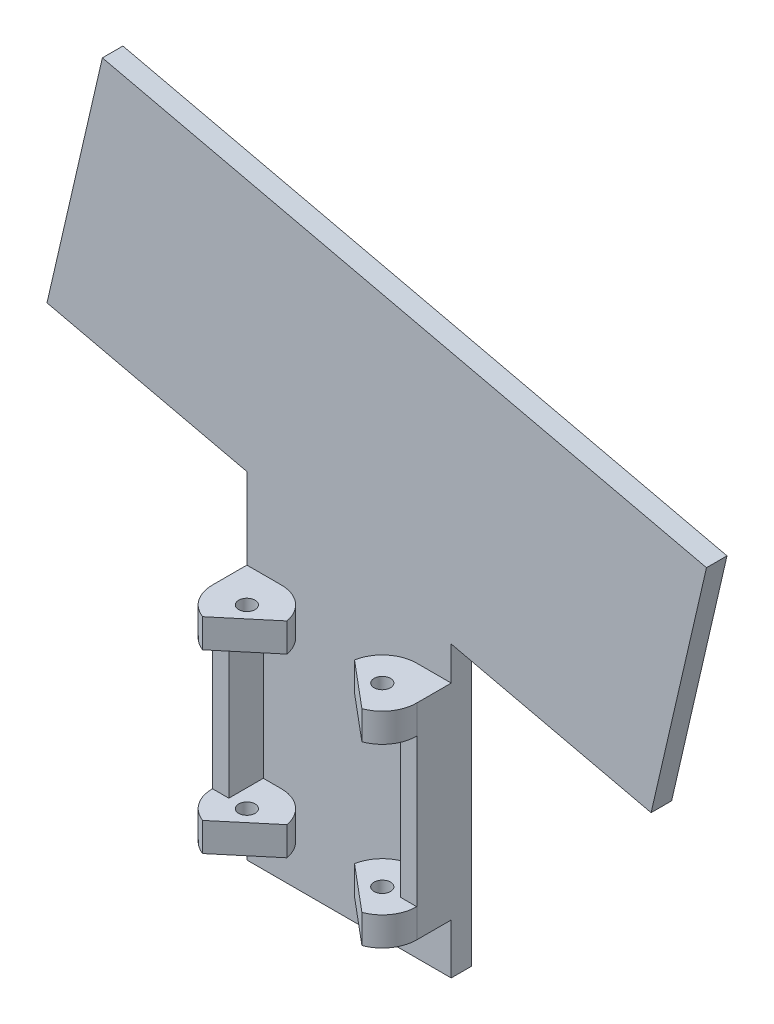
from build123d import *

# Parameters (mm, degrees)
BOSS_EXTRUDE2_DEPTH     = 7
CUT_EXTRUDE2_DEPTH      = 30.130224853
CUT_EXTRUDE2_DEPTH_BACK = 30.130224853
SKETCH3_R               = 2
BOSS_EXTRUDE3_DEPTH     = 36
SKETCH5_R               = 2
BOSS_EXTRUDE4_DEPTH     = 7
SKETCH14_W              = 49.8
SKETCH14_H              = 5
BOSS_EXTRUDE7_DEPTH     = 8.25
SKETCH16_W              = 49.8
SKETCH16_H              = 5
BOSS_EXTRUDE8_DEPTH     = 12.25
BOSS_EXTRUDE9_DEPTH     = 5


with BuildPart() as part:
    # Sketch1 → Boss-Extrude2 (new body)
    with BuildSketch(Plane(origin=(0, 0, 0), x_dir=(1, 0, 0), z_dir=(0, 1, 0))):
        with BuildLine():
            Line((-24.9, 0), (-24.9, 13.4))
            Line((-24.9, 13.4), (24.9, 13.4))
            Line((24.9, 13.4), (24.9, 0))
            ThreePointArc((24.9, 0), (23.392904185, -4.800819919), (19.412411454, -7.878950407))
            Line((19.412411454, -7.878950407), (8.235013612, 1.5))
            ThreePointArc((8.235013612, 1.5), (11.116692467, 6.448255578), (16.5, 8.4))
            Line((16.5, 8.4), (-16.5, 8.4))
            ThreePointArc((-16.5, 8.4), (-11.116692467, 6.448255578), (-8.235013612, 1.5))
            Line((-8.235013612, 1.5), (-19.412411454, -7.878950407))
            ThreePointArc((-19.412411454, -7.878950407), (-23.392904185, -4.800819919), (-24.9, 0))
        make_face()
    extrude(amount=BOSS_EXTRUDE2_DEPTH)

    # Sketch3 → Cut-Extrude2 (cut, two sides: drawn at the far end of the back side and taken through both)
    with BuildSketch(Plane(origin=(0, 7, 0), x_dir=(1, 0, 0), z_dir=(0, 1, 0)).offset(-CUT_EXTRUDE2_DEPTH_BACK)):
        with Locations((-16.5, 0)):
            Circle(SKETCH3_R)
        with Locations((16.5, 0)):
            Circle(SKETCH3_R)
    extrude(amount=CUT_EXTRUDE2_DEPTH + CUT_EXTRUDE2_DEPTH_BACK, mode=Mode.SUBTRACT)

    # Sketch4 → Boss-Extrude3 (add)
    with BuildSketch(Plane(origin=(0, 7, 0), x_dir=(1, 0, 0), z_dir=(0, 1, 0))):
        Polygon((-24.9, 13.4), (-24.9, 0), (-20.9, 0), (-20.9, 8.4), (-16.5, 8.4), (16.5, 8.4), (20.9, 8.4), (20.9, 0), (24.9, 0), (24.9, 13.4), align=None)
    extrude(amount=BOSS_EXTRUDE3_DEPTH)

    # Sketch5 → Boss-Extrude4 (add)
    with BuildSketch(Plane(origin=(0, 43, 0), x_dir=(1, 0, 0), z_dir=(0, 1, 0))):
        with BuildLine():
            Line((-24.9, 13.4), (-24.9, 0))
            ThreePointArc((-24.9, 0), (-23.392904185, -4.800819919), (-19.412411454, -7.878950407))
            Line((-19.412411454, -7.878950407), (-8.235013612, 1.5))
            ThreePointArc((-8.235013612, 1.5), (-11.116692467, 6.448255578), (-16.5, 8.4))
            Line((-16.5, 8.4), (16.5, 8.4))
            ThreePointArc((16.5, 8.4), (11.116692467, 6.448255578), (8.235013612, 1.5))
            Line((8.235013612, 1.5), (19.412411454, -7.878950407))
            ThreePointArc((19.412411454, -7.878950407), (23.392904185, -4.800819919), (24.9, 0))
            Line((24.9, 0), (24.9, 13.4))
            Line((24.9, 13.4), (-24.9, 13.4))
        make_face()
        with Locations((16.5, 0)):
            Circle(SKETCH5_R, mode=Mode.SUBTRACT)
        with Locations((-16.5, 0)):
            Circle(SKETCH5_R, mode=Mode.SUBTRACT)
    extrude(amount=BOSS_EXTRUDE4_DEPTH)

    # Sketch14 → Boss-Extrude7 (add)
    with BuildSketch(Plane(origin=(0, 50, 0), x_dir=(1, 0, 0), z_dir=(0, 1, 0))):
        with Locations((0, 10.9)):
            Rectangle(SKETCH14_W, SKETCH14_H)
    extrude(amount=BOSS_EXTRUDE7_DEPTH)

    # Sketch16 → Boss-Extrude8 (add)
    with BuildSketch(Plane.XZ):
        with Locations((0, -10.9)):
            Rectangle(SKETCH16_W, SKETCH16_H)
    extrude(amount=BOSS_EXTRUDE8_DEPTH)

    # Sketch17 → Boss-Extrude9 (add)
    with BuildSketch(Plane(origin=(0, 0, -13.4), x_dir=(-1, 0, 0), z_dir=(0, 0, -1))):
        Polygon((24.9, 58.25), (-24.9, 58.25), (-73.618503239, 47.002447283), (-87.1155665, 105.46465117), (60.121439979, 139.456992522), (73.618503239, 80.994788635), (24.9, 69.747235918), align=None)
    extrude(amount=-BOSS_EXTRUDE9_DEPTH)


solid = part.part
